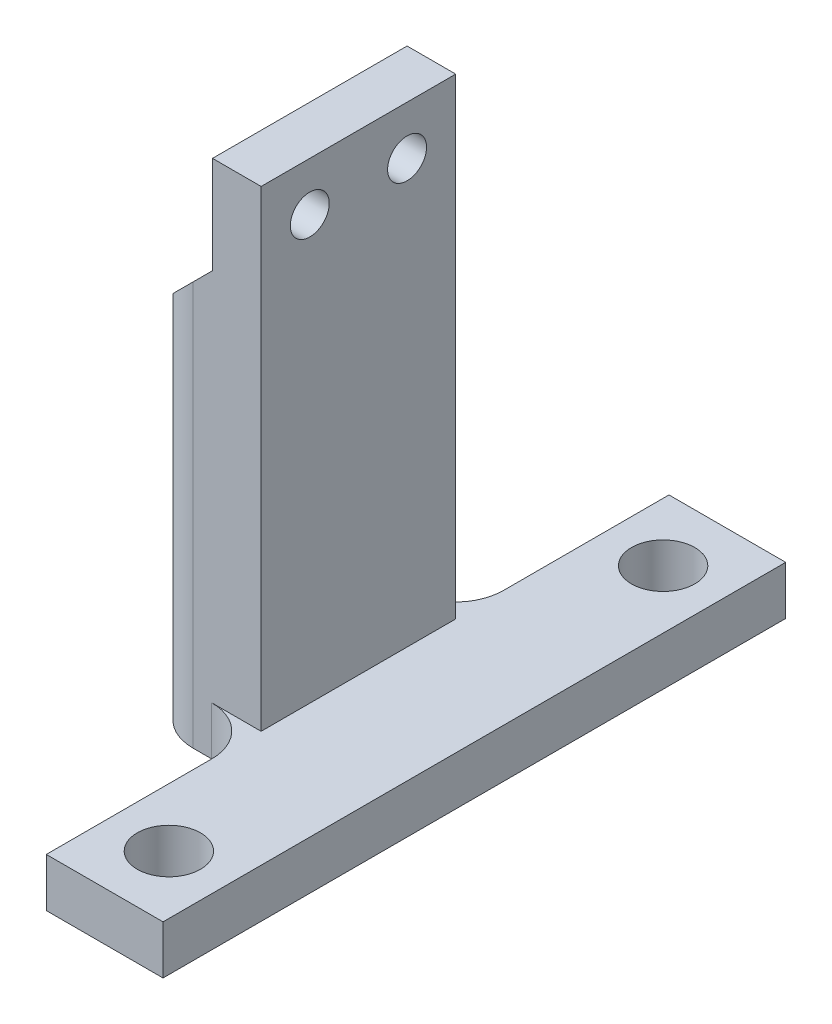
from build123d import *

# Parameters (mm, degrees)
BOSS_EXTRUDE1_DEPTH                = 5
F_1_4_0_25_CLEARANCE_DOWEL_HOLE2_D = 6.499999954
SKETCH4_W                          = 12
SKETCH4_H                          = 20
BOSS_EXTRUDE2_DEPTH                = 48.5
SKETCH5_W                          = 20
SKETCH5_H                          = 10
CUT_EXTRUDE1_DEPTH                 = 7
F_4_0MM_CLEARANCE_DOWEL_HOLE1_D    = 4
CHAMFER1_SIZE                      = 7
FILLET1_R                          = 5


with BuildPart() as part:
    # Sketch1 → Boss-Extrude1 (new body)
    with BuildSketch(Plane(origin=(0, 0, 0), x_dir=(1, 0, 0), z_dir=(0, 1, 0))):
        Polygon((0, -10), (0, 10), (11.917176452, 10), (11.917176452, 32), (23.917176452, 32), (23.917176452, -32), (11.917176452, -32), (11.917176452, -10), align=None)
    extrude(amount=BOSS_EXTRUDE1_DEPTH)

    # 1/4 (0.25) Clearance Dowel Hole2 (through all)
    with Locations(Plane(origin=(0, 5, 0), x_dir=(1, 0, 0), z_dir=(0, 1, 0))):
        with Locations((17.917176452, -25.4), (17.917176452, 25.4)):
            Hole(F_1_4_0_25_CLEARANCE_DOWEL_HOLE2_D / 2)

    # Sketch4 → Boss-Extrude2 (add)
    with BuildSketch(Plane(origin=(0, 5, 0), x_dir=(1, 0, 0), z_dir=(0, 1, 0))):
        with Locations((6, 0)):
            Rectangle(SKETCH4_W, SKETCH4_H)
    extrude(amount=BOSS_EXTRUDE2_DEPTH)

    # Sketch5 → Cut-Extrude1 (cut)
    with BuildSketch(Plane.ZY):
        with Locations((0, 48.5)):
            Rectangle(SKETCH5_W, SKETCH5_H)
    extrude(amount=-CUT_EXTRUDE1_DEPTH, mode=Mode.SUBTRACT)

    # Ø4.0mm Clearance Dowel Hole1 (through all)
    with Locations(Plane.ZY.offset(-7)):
        with Locations((-5, 48.5), (5, 48.5)):
            Hole(F_4_0MM_CLEARANCE_DOWEL_HOLE1_D / 2)

    # Chamfer1
    chamfer1_edges = [part.edges().sort_by_distance(p)[0] for p in [
        (0, 43.5, 0),
    ]]
    chamfer(chamfer1_edges, length=CHAMFER1_SIZE - 0.0001)  # a hair under: the kernel refuses the full size

    # Fillet1
    fillet1_edges = [part.edges().sort_by_distance(p)[0] for p in [
        (11.917176452, 2.5, 10),
        (11.917176452, 2.5, -10),
        (0, 18.25005, 10),
        (0, 18.25005, -10),
    ]]
    fillet(fillet1_edges, radius=FILLET1_R)


solid = part.part
